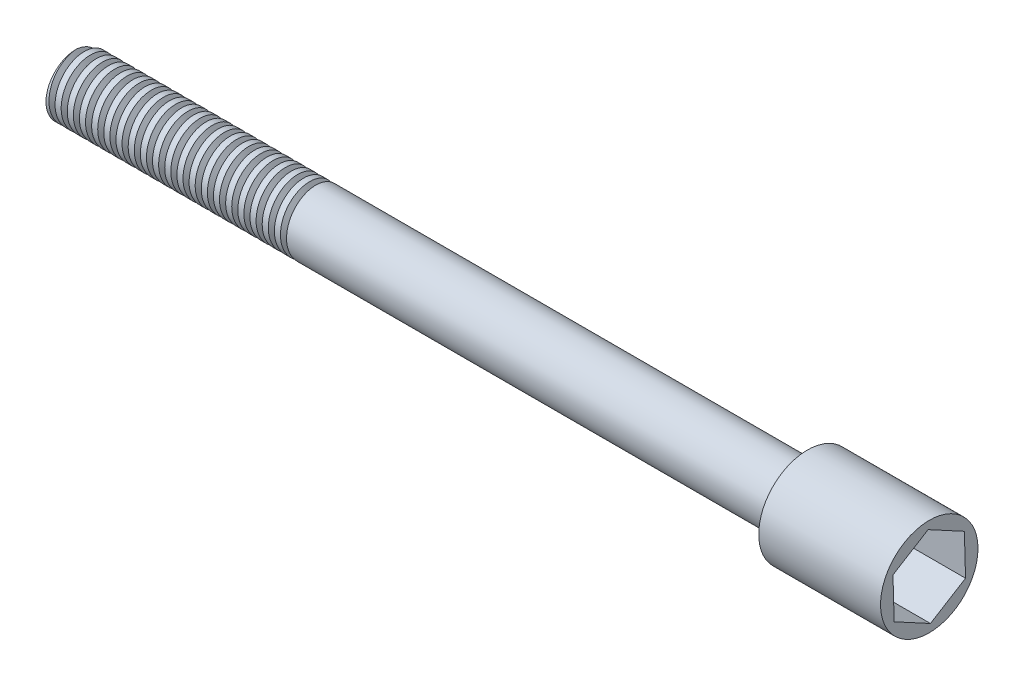
from build123d import *

# Parameters (mm, degrees)
CUT_EXTRUDE1_DEPTH = 7
CUT_SWEEP1_PITCH   = 1


with BuildPart() as part:
    # Sketch1 → Revolve1 (revolve)
    with BuildSketch(Plane.XY, mode=Mode.PRIVATE) as revolve1_sk:
        Polygon((0, 0), (-70, 0), (-70, 2.5), (-10, 2.5), (-10, 4), (0, 4), align=None)
    revolve(revolve1_sk.sketch.rotate(Axis((0, 0, 0), (-1, 0, 0)), 90), axis=Axis((0, 0, 0), (-1, 0, 0)))

    # Sketch2 → Cut-Extrude1 (cut)
    with BuildSketch(Plane(origin=(0, 0, 0), x_dir=(0, 0, -1), z_dir=(1, 0, 0))):
        Polygon((0.096013755, -3.383072885), (2.977833938, -1.608386092), (2.881820184, 1.774686793), (-0.096013755, 3.383072885), (-2.977833938, 1.608386092), (-2.881820184, -1.774686793), align=None)
    extrude(amount=-CUT_EXTRUDE1_DEPTH, mode=Mode.SUBTRACT)

    # Cut-Sweep1: arcs per turn and ends read off the stored shape
    # Cut-Sweep1: the profile of Sketch9 screwed along a right-hand helix through 21 turns, 8 arcs to a turn; built about Z, then put on its axis
    cut_sweep1_z = Axis((0, 0, 0), (0, 0, 1))
    cut_sweep1_corners = [(2.065864065, 0, -1), (2.717067967, 0, -0.624027252), (2.717067967, 0, -1.375972748)]
    with BuildLine(mode=Mode.PRIVATE) as cut_sweep1_profile:
        Line(cut_sweep1_corners[0], cut_sweep1_corners[1])
        Line(cut_sweep1_corners[1], cut_sweep1_corners[2])
        Line(cut_sweep1_corners[2], cut_sweep1_corners[0])
    cut_sweep1_cap = Face(cut_sweep1_profile.wire())
    cut_sweep1_turn_angles = [0, 22.5, 45, 67.5, 90, 112.5, 135, 157.5, 180, 202.5, 225, 247.5, 270, 292.5, 315, 337.5, 360]
    cut_sweep1_turn_weights = [1, 0.9238795325112867, 1, 0.9238795325112867, 1, 0.9238795325112867, 1, 0.9238795325112867, 1, 0.9238795325112867, 1, 0.9238795325112867, 1, 0.9238795325112867, 1, 0.9238795325112867, 1]
    cut_sweep1_turn_rails = [Edge.make_bspline([Vector(p[0], p[1], 0).rotate(cut_sweep1_z, cut_sweep1_turn_angles[k]) / cut_sweep1_turn_weights[k] + Vector(0, 0, p[2] + CUT_SWEEP1_PITCH * cut_sweep1_turn_angles[k] / 360) for k in range(17)], [0, 0, 0, 1, 1, 2, 2, 3, 3, 4, 4, 5, 5, 6, 6, 7, 7, 8, 8, 8], 2, cut_sweep1_turn_weights) for p in cut_sweep1_corners]
    cut_sweep1_turn_sides = [Face.make_surface_from_curves(cut_sweep1_turn_rails[p[0]], cut_sweep1_turn_rails[p[1]]) for p in [(0, 1), (1, 2), (2, 0)]]
    cut_sweep1 = Plane(origin=(-70, 0, 0), x_dir=(0, 0, -1), z_dir=(1, 0, 0)) * Solid(Shell([*[p.moved(Location((0, 0, CUT_SWEEP1_PITCH * i))) for i in range(21) for p in cut_sweep1_turn_sides], cut_sweep1_cap, cut_sweep1_cap.rotate(cut_sweep1_z, 7560).moved(Location((0, 0, CUT_SWEEP1_PITCH * 7560 / 360)))]))
    add(cut_sweep1, mode=Mode.SUBTRACT)


solid = part.part
